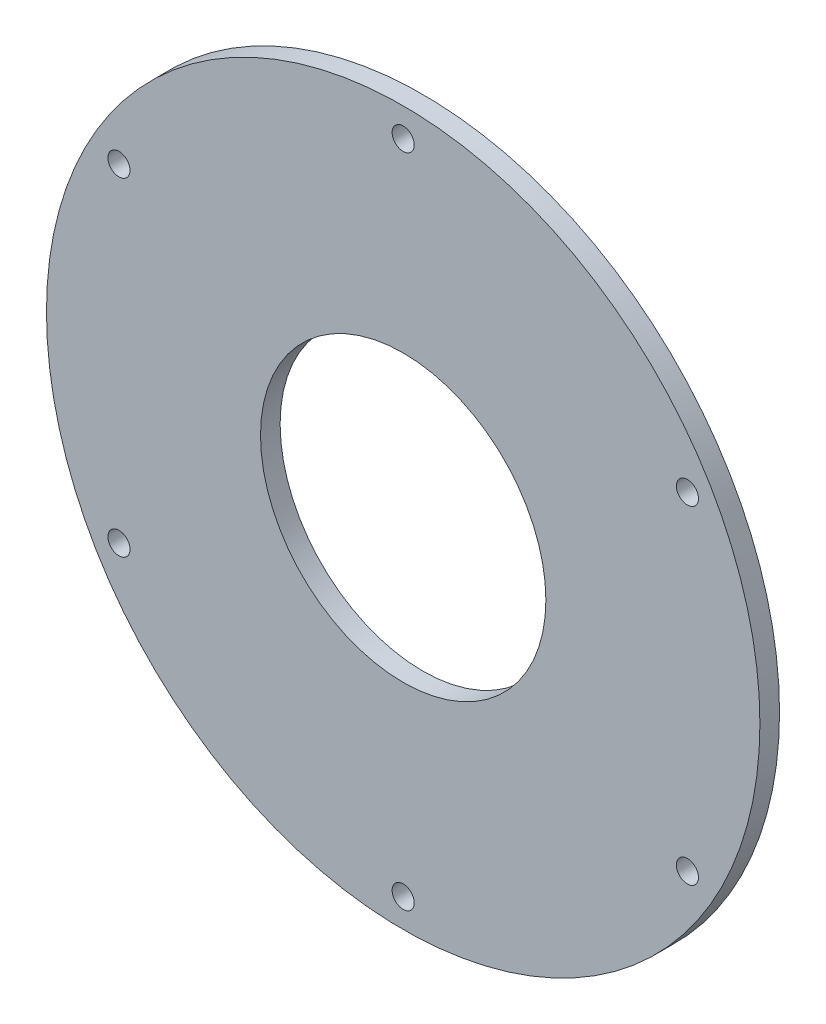
from build123d import *

# Parameters (mm, degrees)
SKIZZE1_R                        = 50
SKIZZE1_R_2                      = 20
AUFSATZ_LINEAR_AUSTRAGEN1_DEPTH  = 2.75
F_3_1_3_1_DURCHMESSER_BOHRUNG1_D = 3.1


with BuildPart() as part:
    # Skizze1 → Aufsatz-Linear austragen1 (new body)
    with BuildSketch(Plane.XY):
        Circle(SKIZZE1_R)
        Circle(SKIZZE1_R_2, mode=Mode.SUBTRACT)
    extrude(amount=AUFSATZ_LINEAR_AUSTRAGEN1_DEPTH)

    # Ø3.1 (3.1) Durchmesser Bohrung1 (through all)
    with Locations(Plane.XY.offset(2.75)):
        with Locations((-39.837168574, 23), (0, 46), (39.837168574, 23), (39.837168574, -23), (0, -46), (-39.837168574, -23)):
            Hole(F_3_1_3_1_DURCHMESSER_BOHRUNG1_D / 2)


solid = part.part
